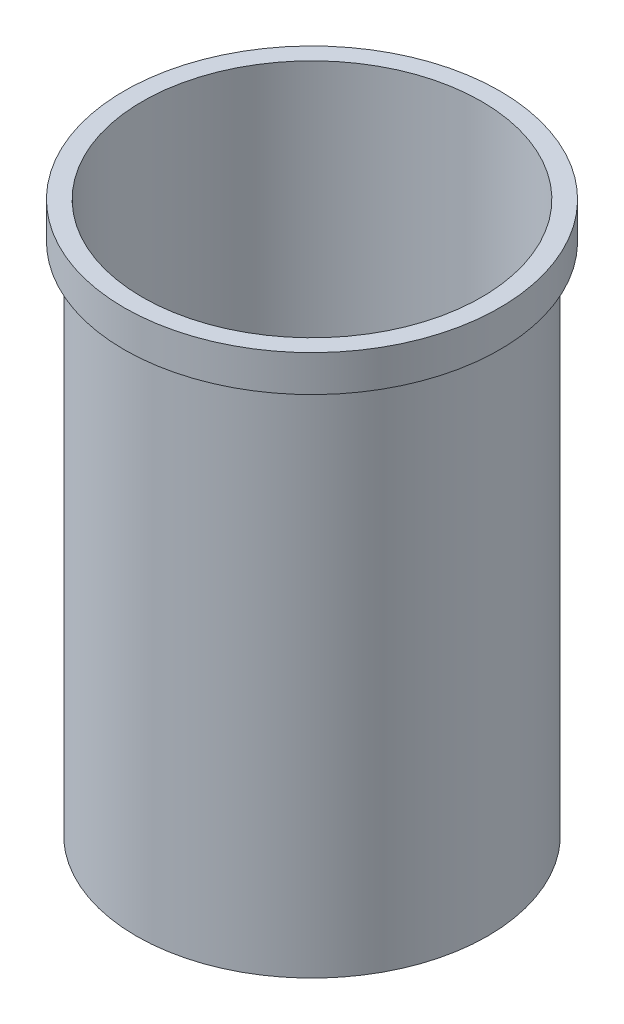
from build123d import *

# Parameters (mm, degrees)
SKETCH1_R           = 58
SKETCH1_R_2         = 56
BOSS_EXTRUDE1_DEPTH = 181.66
BOSS_EXTRUDE2_START = -12
SKETCH3_R           = 62
SKETCH3_R_2         = 58
BOSS_EXTRUDE2_DEPTH = 12


with BuildPart() as part:
    # Sketch1 → Boss-Extrude1 (new body)
    with BuildSketch(Plane(origin=(0, 0, 0), x_dir=(1, 0, 0), z_dir=(0, 1, 0))):
        Circle(SKETCH1_R)
        Circle(SKETCH1_R_2, mode=Mode.SUBTRACT)
    extrude(amount=BOSS_EXTRUDE1_DEPTH)

    # Sketch3 → Boss-Extrude2 (add)
    with BuildSketch(Plane(origin=(0, 181.66, 0), x_dir=(1, 0, 0), z_dir=(0, 1, 0)).offset(BOSS_EXTRUDE2_START)):
        Circle(SKETCH3_R)
        Circle(SKETCH3_R_2, mode=Mode.SUBTRACT)
    extrude(amount=BOSS_EXTRUDE2_DEPTH)


solid = part.part
